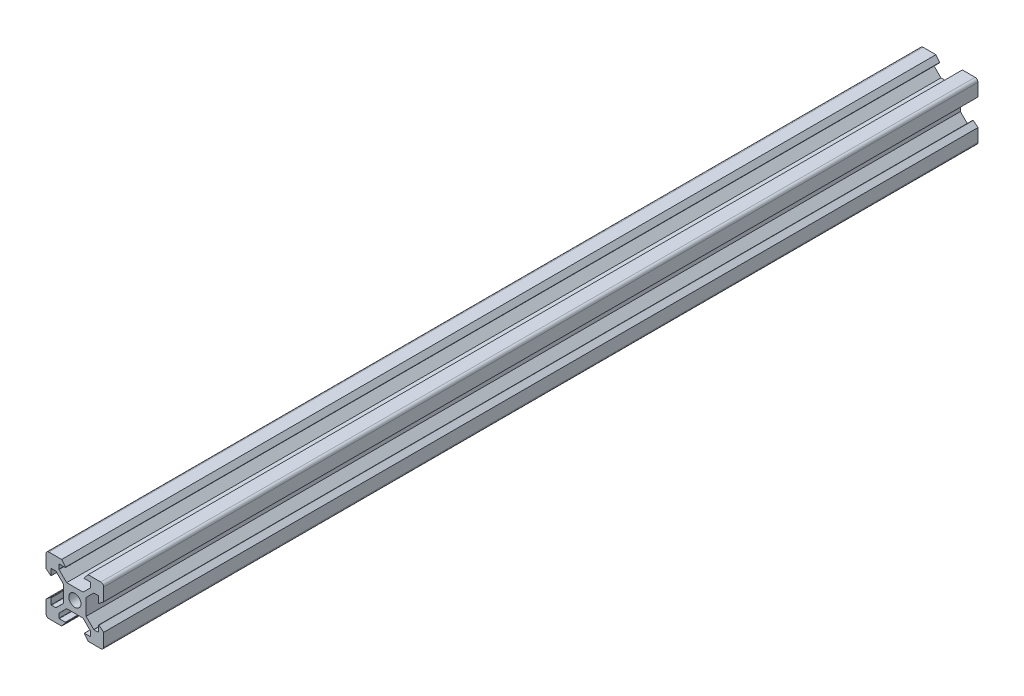
from build123d import *

# Parameters (mm, degrees)
SKETCH1_R           = 2.1
BOSS_EXTRUDE1_DEPTH = 303
FILLET1_R           = 1


with BuildPart() as part:
    # Sketch1 → Boss-Extrude1 (new body)
    with BuildSketch(Plane.XY):
        with BuildLine():
            Line((-2.839339828, 3.9), (-5.470710678, 6.53137085))
            ThreePointArc((-5.470710678, 6.53137085), (-5.492387953, 6.563813185), (-5.5, 6.602081528))
            Line((-5.5, 6.602081528), (-5.5, 8.1))
            ThreePointArc((-5.5, 8.1), (-5.470710678, 8.170710678), (-5.4, 8.2))
            Line((-5.4, 8.2), (-3.334418044, 8.2))
            ThreePointArc((-3.334418044, 8.2), (-3.244178397, 8.256909326), (-3.2566483, 8.362863876))
            Line((-3.2566483, 8.362863876), (-4.58, 10))
            Line((-4.58, 10), (-10, 10))
            Line((-10, 10), (-10, 4.58))
            Line((-10, 4.58), (-8.362863876, 3.2566483))
            ThreePointArc((-8.362863876, 3.2566483), (-8.256909326, 3.244178397), (-8.2, 3.334418044))
            Line((-8.2, 3.334418044), (-8.2, 5.4))
            ThreePointArc((-8.2, 5.4), (-8.170710678, 5.470710678), (-8.1, 5.5))
            Line((-8.1, 5.5), (-6.602081528, 5.5))
            ThreePointArc((-6.602081528, 5.5), (-6.563813185, 5.492387953), (-6.53137085, 5.470710678))
            Line((-6.53137085, 5.470710678), (-3.9, 2.839339828))
            Line((-3.9, 2.839339828), (-3.9, -2.839339828))
            Line((-3.9, -2.839339828), (-6.53137085, -5.470710678))
            ThreePointArc((-6.53137085, -5.470710678), (-6.563813185, -5.492387953), (-6.602081528, -5.5))
            Line((-6.602081528, -5.5), (-8.1, -5.5))
            ThreePointArc((-8.1, -5.5), (-8.170710678, -5.470710678), (-8.2, -5.4))
            Line((-8.2, -5.4), (-8.2, -3.334418044))
            ThreePointArc((-8.2, -3.334418044), (-8.256909326, -3.244178397), (-8.362863876, -3.2566483))
            Line((-8.362863876, -3.2566483), (-10, -4.58))
            Line((-10, -4.58), (-10, -10))
            Line((-10, -10), (-4.58, -10))
            Line((-4.58, -10), (-3.2566483, -8.362863876))
            ThreePointArc((-3.2566483, -8.362863876), (-3.244178397, -8.256909326), (-3.334418044, -8.2))
            Line((-3.334418044, -8.2), (-5.4, -8.2))
            ThreePointArc((-5.4, -8.2), (-5.470710678, -8.170710678), (-5.5, -8.1))
            Line((-5.5, -8.1), (-5.5, -6.602081528))
            ThreePointArc((-5.5, -6.602081528), (-5.492387953, -6.563813185), (-5.470710678, -6.53137085))
            Line((-5.470710678, -6.53137085), (-2.839339828, -3.9))
            Line((-2.839339828, -3.9), (2.839339828, -3.9))
            Line((2.839339828, -3.9), (5.470710678, -6.53137085))
            ThreePointArc((5.470710678, -6.53137085), (5.492387953, -6.563813185), (5.5, -6.602081528))
            Line((5.5, -6.602081528), (5.5, -8.1))
            ThreePointArc((5.5, -8.1), (5.470710678, -8.170710678), (5.4, -8.2))
            Line((5.4, -8.2), (3.334418044, -8.2))
            ThreePointArc((3.334418044, -8.2), (3.244178397, -8.256909326), (3.2566483, -8.362863876))
            Line((3.2566483, -8.362863876), (4.58, -10))
            Line((4.58, -10), (10, -10))
            Line((10, -10), (10, -4.58))
            Line((10, -4.58), (8.362863876, -3.2566483))
            ThreePointArc((8.362863876, -3.2566483), (8.256909326, -3.244178397), (8.2, -3.334418044))
            Line((8.2, -3.334418044), (8.2, -5.4))
            ThreePointArc((8.2, -5.4), (8.170710678, -5.470710678), (8.1, -5.5))
            Line((8.1, -5.5), (6.602081528, -5.5))
            ThreePointArc((6.602081528, -5.5), (6.563813185, -5.492387953), (6.53137085, -5.470710678))
            Line((6.53137085, -5.470710678), (3.9, -2.839339828))
            Line((3.9, -2.839339828), (3.9, 2.839339828))
            Line((3.9, 2.839339828), (6.53137085, 5.470710678))
            ThreePointArc((6.53137085, 5.470710678), (6.563813185, 5.492387953), (6.602081528, 5.5))
            Line((6.602081528, 5.5), (8.1, 5.5))
            ThreePointArc((8.1, 5.5), (8.170710678, 5.470710678), (8.2, 5.4))
            Line((8.2, 5.4), (8.2, 3.334418044))
            ThreePointArc((8.2, 3.334418044), (8.256909326, 3.244178397), (8.362863876, 3.2566483))
            Line((8.362863876, 3.2566483), (10, 4.58))
            Line((10, 4.58), (10, 10))
            Line((10, 10), (4.58, 10))
            Line((4.58, 10), (3.2566483, 8.362863876))
            ThreePointArc((3.2566483, 8.362863876), (3.244178397, 8.256909326), (3.334418044, 8.2))
            Line((3.334418044, 8.2), (5.4, 8.2))
            ThreePointArc((5.4, 8.2), (5.470710678, 8.170710678), (5.5, 8.1))
            Line((5.5, 8.1), (5.5, 6.602081528))
            ThreePointArc((5.5, 6.602081528), (5.492387953, 6.563813185), (5.470710678, 6.53137085))
            Line((5.470710678, 6.53137085), (2.839339828, 3.9))
            Line((2.839339828, 3.9), (-2.839339828, 3.9))
        make_face()
        Circle(SKETCH1_R, mode=Mode.SUBTRACT)
    extrude(amount=BOSS_EXTRUDE1_DEPTH)

    # Fillet1
    fillet1_edges = [part.edges().sort_by_distance(p)[0] for p in [
        (10, -10, 151.5),
        (10, 10, 151.5),
        (-10, -10, 151.5),
        (-10, 10, 151.5),
    ]]
    fillet(fillet1_edges, radius=FILLET1_R)


solid = part.part
